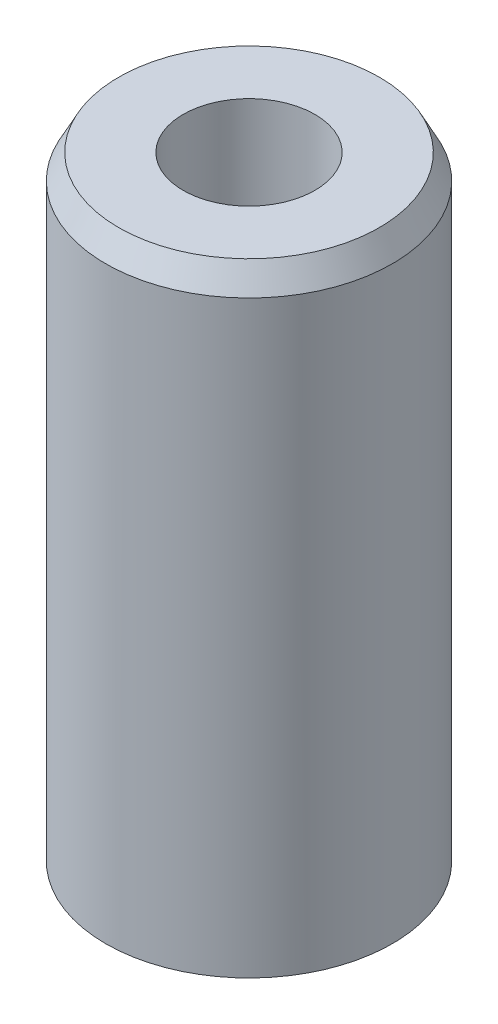
from build123d import *
from OCP.BRepFilletAPI import BRepFilletAPI_MakeChamfer

# Parameters (mm, degrees)
SKETCH1_R           = 27.5
BOSS_EXTRUDE1_DEPTH = 120.225529743
SKETCH2_R           = 12.639016572
CUT_EXTRUDE1_DEPTH  = 127.359320994
CHAMFER1_SIZE       = 4.755075303
CHAMFER1_SIZE2      = 2.494836194


with BuildPart() as part:
    # Sketch1 → Boss-Extrude1 (new body)
    with BuildSketch(Plane(origin=(0, 0, 0), x_dir=(1, 0, 0), z_dir=(0, 1, 0))):
        Circle(SKETCH1_R)
    extrude(amount=BOSS_EXTRUDE1_DEPTH)

    # Sketch2 → Cut-Extrude1 (cut, through all)
    with BuildSketch(Plane(origin=(0, 0, 0), x_dir=(1, 0, 0), z_dir=(0, 1, 0))):
        Circle(SKETCH2_R)
    extrude(amount=CUT_EXTRUDE1_DEPTH, mode=Mode.SUBTRACT)

    # Chamfer1: one chamfer whose edges measure the first distance from different faces: ONE call of the kernel's chamfer builder (chamfer() names one face for all edges)
    chamfer1_edges_1 = [part.edges().sort_by_distance(p)[0] for p in [
        (-27.5, 120.225529743, 0),
    ]]
    chamfer1_side_1 = [part.faces().sort_by_distance(p)[0] for p in [
        (-27.5, 60.112764872, 0),
    ]]
    chamfer1_edges_2 = [part.edges().sort_by_distance(p)[0] for p in [
        (-27.5, 0, 0),
    ]]
    chamfer1_side_2 = [part.faces().sort_by_distance(p)[0] for p in [
        (-26.722182541, 0, 0),
    ]]
    chamfer1 = BRepFilletAPI_MakeChamfer(part.part.solid().wrapped)
    for e in chamfer1_edges_1:
        chamfer1.Add(CHAMFER1_SIZE, CHAMFER1_SIZE2, e.wrapped, chamfer1_side_1[0].wrapped)  # the first distance lies on this face
    for e in chamfer1_edges_2:
        chamfer1.Add(CHAMFER1_SIZE, CHAMFER1_SIZE2, e.wrapped, chamfer1_side_2[0].wrapped)  # the first distance lies on this face
    add(Compound.cast(chamfer1.Shape()), mode=Mode.REPLACE)


solid = part.part
